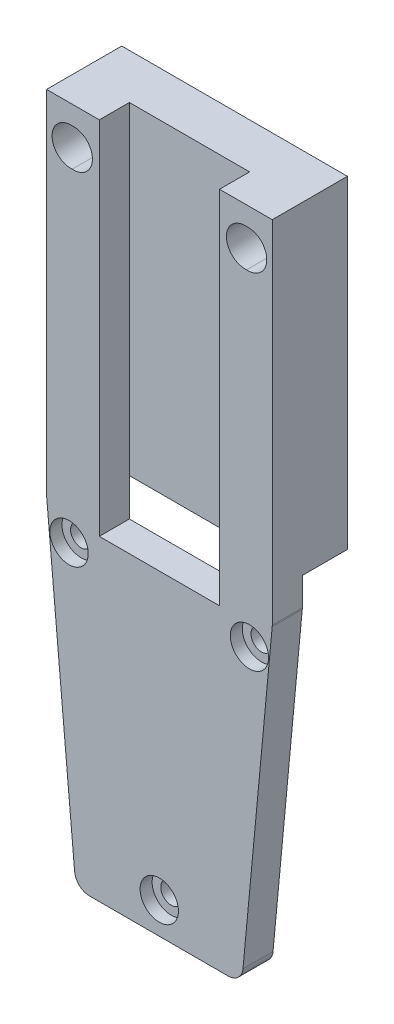
from build123d import *

# Parameters (mm, degrees)
BOSS_EXTRUDE1_OUTLINE_R  = 0.7
BOSS_EXTRUDE1_DEPTH      = 2
BOSS_EXTRUDE2_DEPTH      = 0.86
BOSS_EXTRUDE2_DEPTH_BACK = 1
SKETCH2_W                = 15.014867696
SKETCH2_H                = 2
SKETCH3_W                = 8
SKETCH3_H                = 5
CUT_EXTRUDE1_DEPTH       = 23.82865975
SKETCH4_W                = 15.014867696
SKETCH4_H                = 1.5
BOSS_EXTRUDE3_DEPTH      = 5
SKETCH5_W                = 8
SKETCH5_H                = 4
CUT_EXTRUDE2_DEPTH       = 3
BOSS_EXTRUDE5_DEPTH      = 20
SKETCH9_R                = 1.275
CUT_EXTRUDE3_DEPTH       = 0.8
HOLE1_START              = -3
HOLE1_OUTLINE_R          = 1.25
HOLE1_DEPTH              = 5
HOLE2_START              = -3
HOLE2_DEPTH              = 5


# Read off the part's stored shape, not the designer's step: Boss-Extrude1, Hole1, Hole2
with BuildPart() as part:
    # Boss-Extrude1 outline → Boss-Extrude1 (new body)
    with BuildSketch(Plane.XY):
        with BuildLine():
            ThreePointArc((7.514083588, 19.508491868), (7.257921972, 20.275277178), (6.518471313, 20.602066422))
            Line((6.518471313, 20.602066422), (-6.496396384, 20.602066422))
            ThreePointArc((-6.496396384, 20.602066422), (-7.234510066, 20.276742783), (-7.49237209, 19.512442807))
            Line((-7.49237209, 19.512442807), (-5.630745451, -1.175574425))
            ThreePointArc((-5.630745451, -1.175574425), (-5.309446106, -1.824064491), (-4.634769745, -2.085950809))
            Line((-4.634769745, -2.085950809), (4.574067822, -2.085950809))
            ThreePointArc((4.574067822, -2.085950809), (5.247278579, -1.825401468), (5.569680097, -1.179525363))
            Line((5.569680097, -1.179525363), (7.514083588, 19.508491868))
        make_face()
        Circle(BOSS_EXTRUDE1_OUTLINE_R, mode=Mode.SUBTRACT)
        with Locations((-5.999999992, 17.596194699)):
            Circle(BOSS_EXTRUDE1_OUTLINE_R, mode=Mode.SUBTRACT)
        with Locations((6.000000016, 17.596194697)):
            Circle(BOSS_EXTRUDE1_OUTLINE_R, mode=Mode.SUBTRACT)
    extrude(amount=BOSS_EXTRUDE1_DEPTH)

    # Sketch2 → Boss-Extrude2 (add, two sides: drawn at the far end of the back side and taken through both)
    with BuildSketch(Plane(origin=(0, 20.602066422, 0), x_dir=(1, 0, 0), z_dir=(0, 1, 0)).offset(-BOSS_EXTRUDE2_DEPTH_BACK)):
        with Locations((0.011037464, -1)):
            Rectangle(SKETCH2_W, SKETCH2_H)
    extrude(amount=BOSS_EXTRUDE2_DEPTH + BOSS_EXTRUDE2_DEPTH_BACK)

    # Sketch3 → Cut-Extrude1 (cut, through all)
    with BuildSketch(Plane(origin=(0, 0, 0), x_dir=(-1, 0, 0), z_dir=(0, 0, -1))):
        with Locations((-0.011037464, 21.462066422)):
            Rectangle(SKETCH3_W, SKETCH3_H)
    extrude(amount=-CUT_EXTRUDE1_DEPTH, mode=Mode.SUBTRACT)

    # Sketch4 → Boss-Extrude3 (add)
    with BuildSketch(Plane.XY.offset(2)):
        with Locations((0.011037464, 22.212066422)):
            Rectangle(SKETCH4_W, SKETCH4_H)
    extrude(amount=-BOSS_EXTRUDE3_DEPTH)

    # Sketch5 → Cut-Extrude2 (cut)
    with BuildSketch(Plane(origin=(0, 22.962066422, 0), x_dir=(1, 0, 0), z_dir=(0, 1, 0))):
        with Locations((0.011037464, -2)):
            Rectangle(SKETCH5_W, SKETCH5_H)
    extrude(amount=-CUT_EXTRUDE2_DEPTH, mode=Mode.SUBTRACT)

    # Sketch6 → Boss-Extrude5 (add)
    with BuildSketch(Plane(origin=(0, 22.962066422, 0), x_dir=(1, 0, 0), z_dir=(0, 1, 0))):
        Polygon((-3.988962536, 0), (4.011037464, 0), (4.011037464, -2), (7.518471312, -2), (7.518471312, 3), (-7.496396384, 3), (-7.496396384, -2), (-3.988962536, -2), align=None)
    extrude(amount=BOSS_EXTRUDE5_DEPTH)

    # Sketch9 → Cut-Extrude3 (cut)
    with BuildSketch(Plane.XY.offset(2)):
        with Locations((-5.999999992, 17.596194699)):
            Circle(SKETCH9_R)
        with Locations((6.000000016, 17.596194697)):
            Circle(SKETCH9_R)
        Circle(SKETCH9_R)
    extrude(amount=-CUT_EXTRUDE3_DEPTH, mode=Mode.SUBTRACT)

    # Hole1 outline → Hole1 (cut)
    with BuildSketch(Plane.XY.offset(HOLE1_START)):
        with Locations((-5.881528688, 40.468009485)):
            Circle(HOLE1_OUTLINE_R)
        with Locations((5.718471312, 40.468009485)):
            Circle(HOLE1_OUTLINE_R)
    extrude(amount=HOLE1_DEPTH, mode=Mode.SUBTRACT)

    # Hole2 outline → Hole2 (cut)
    with BuildSketch(Plane.XY.offset(HOLE2_START)):
        with BuildLine():
            ThreePointArc((5.811037464, 41.714577376), (6.968471312, 40.468009485), (5.811037464, 39.221441594))
            ThreePointArc((5.811037464, 39.221441594), (7.153603616, 40.468009485), (5.811037464, 41.714577376))
        make_face()
        with BuildLine():
            ThreePointArc((-5.788962536, 41.714577376), (-4.631528688, 40.468009485), (-5.788962536, 39.221441594))
            ThreePointArc((-5.788962536, 39.221441594), (-4.446396384, 40.468009485), (-5.788962536, 41.714577376))
        make_face()
    extrude(amount=HOLE2_DEPTH, mode=Mode.SUBTRACT)


solid = part.part
